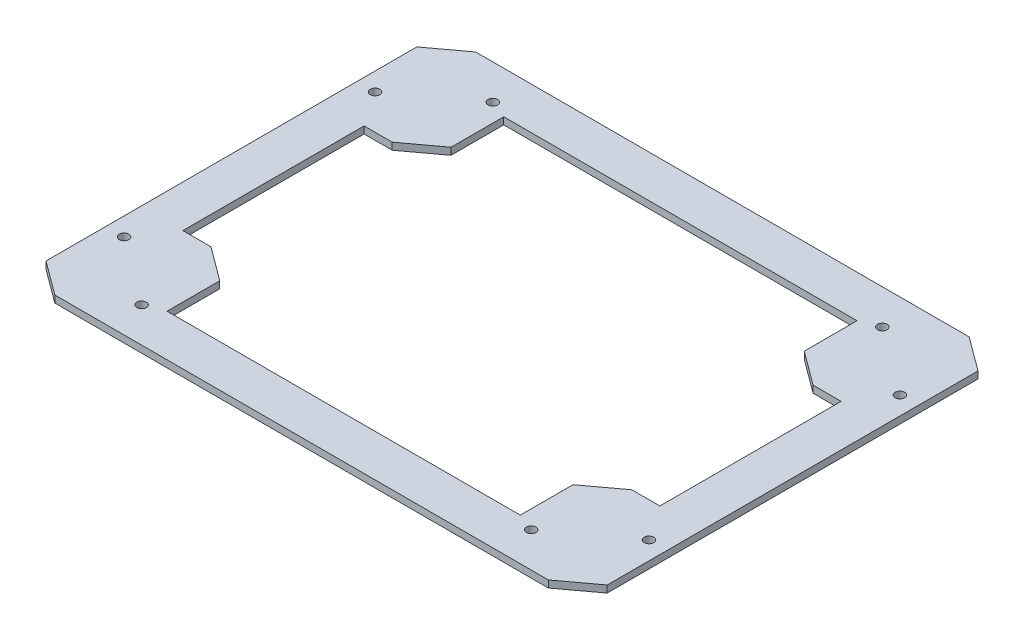
from build123d import *

# Parameters (mm, degrees)
BOSS_EXTRUDE1_DEPTH = 3.175
SKETCH2_R           = 2.159
CUT_EXTRUDE1_DEPTH  = 159.781746826


with BuildPart() as part:
    # Sketch1 → Boss-Extrude1 (new body)
    with BuildSketch(Plane(origin=(0, 0, 0), x_dir=(1, 0, 0), z_dir=(0, 1, 0))):
        Polygon((-111.686526805, 95.25), (-127, 83.918625912), (-127, -83.918625912), (-111.686526805, -95.25), (111.686526805, -95.25), (127, -83.918625912), (127, 83.918625912), (111.686526805, 95.25), align=None)
        Polygon((-107.95, -41.010963508), (-107.95, 41.010963508), (-95.25, 41.010963508), (-79.936526805, 52.342337595), (-79.936526805, 76.2), (38.831798823, 76.2), (79.936526805, 76.2), (79.936526805, 52.342337595), (95.25, 41.010963508), (107.95, 41.010963508), (107.95, -41.010963508), (95.25, -41.010963508), (79.936526805, -52.342337595), (79.936526805, -76.2), (38.1, -76.2), (-79.936526805, -76.2), (-79.936526805, -52.342337595), (-95.25, -41.010963508), align=None, mode=Mode.SUBTRACT)
    extrude(amount=BOSS_EXTRUDE1_DEPTH)

    # Sketch2 → Cut-Extrude1 (cut, through all)
    with BuildSketch(Plane(origin=(0, 3.175, 0), x_dir=(1, 0, 0), z_dir=(0, 1, 0))):
        with Locations((-88.154790208, 79.461855841)):
            Circle(SKETCH2_R)
        with Locations((88.154790208, 79.461855841)):
            Circle(SKETCH2_R)
        with Locations((88.154790208, -79.461855841)):
            Circle(SKETCH2_R)
        with Locations((-88.154790208, -79.461855841)):
            Circle(SKETCH2_R)
        with Locations((-118.781736597, 56.799107666)):
            Circle(SKETCH2_R)
        with Locations((118.781736597, 56.799107666)):
            Circle(SKETCH2_R)
        with Locations((-118.781736597, -56.799107666)):
            Circle(SKETCH2_R)
        with Locations((118.781736597, -56.799107666)):
            Circle(SKETCH2_R)
    extrude(amount=-CUT_EXTRUDE1_DEPTH, mode=Mode.SUBTRACT)


solid = part.part
